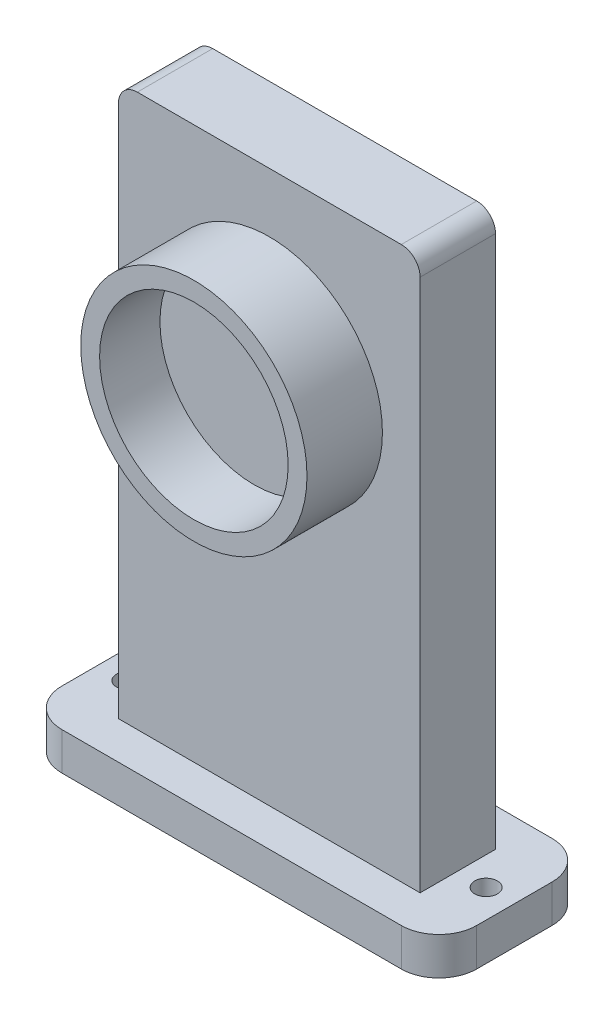
from build123d import *

# Parameters (mm, degrees)
SKETCH1_W           = 40
SKETCH1_H           = 110.7
BOSS_EXTRUDE1_DEPTH = 10
SKETCH4_R           = 15
BOSS_EXTRUDE3_DEPTH = 10
SKETCH5_R           = 12.5
CUT_EXTRUDE2_DEPTH  = 8
SKETCH6_W           = 40
SKETCH6_H           = 10
CUT_EXTRUDE3_DEPTH  = 32.5
FILLET4_R           = 2.5
SKETCH11_R          = 1.5
SKETCH11_W          = 40
SKETCH11_H          = 10
BOSS_EXTRUDE4_DEPTH = 5


with BuildPart() as part:
    # Sketch1 → Boss-Extrude1 (new body)
    with BuildSketch(Plane.XY):
        Rectangle(SKETCH1_W, SKETCH1_H)
    extrude(amount=BOSS_EXTRUDE1_DEPTH)

    # Sketch4 → Boss-Extrude3 (add)
    with BuildSketch(Plane.XY.offset(10)):
        Circle(SKETCH4_R)
    extrude(amount=BOSS_EXTRUDE3_DEPTH)

    # Sketch5 → Cut-Extrude2 (cut)
    with BuildSketch(Plane.XY.offset(20)):
        Circle(SKETCH5_R)
    extrude(amount=-CUT_EXTRUDE2_DEPTH, mode=Mode.SUBTRACT)

    # Sketch6 → Cut-Extrude3 (cut)
    with BuildSketch(Plane(origin=(0, 55.35, 0), x_dir=(1, 0, 0), z_dir=(0, 1, 0))):
        with Locations((0, -5)):
            Rectangle(SKETCH6_W, SKETCH6_H)
    extrude(amount=-CUT_EXTRUDE3_DEPTH, mode=Mode.SUBTRACT)

    # Fillet4
    fillet4_edges = [part.edges().sort_by_distance(p)[0] for p in [
        (20, 22.85, 5),
        (-20, 22.85, 5),
    ]]
    fillet(fillet4_edges, radius=FILLET4_R)

    # Sketch11 → Boss-Extrude4 (add)
    with BuildSketch(Plane.XZ.offset(55.35)):
        with BuildLine():
            Line((-22.5, 15), (22.5, 15))
            ThreePointArc((22.5, 15), (26.035533906, 13.535533906), (27.5, 10))
            Line((27.5, 10), (27.5, 0))
            ThreePointArc((27.5, 0), (26.035533906, -3.535533906), (22.5, -5))
            Line((22.5, -5), (-22.5, -5))
            ThreePointArc((-22.5, -5), (-26.035533906, -3.535533906), (-27.5, 0))
            Line((-27.5, 0), (-27.5, 10))
            ThreePointArc((-27.5, 10), (-26.035533906, 13.535533906), (-22.5, 15))
        make_face()
        with Locations((-23.75, 5)):
            Circle(SKETCH11_R, mode=Mode.SUBTRACT)
        with Locations((23.75, 5)):
            Circle(SKETCH11_R, mode=Mode.SUBTRACT)
        with Locations((0, 5)):
            Rectangle(SKETCH11_W, SKETCH11_H, mode=Mode.SUBTRACT)
    extrude(amount=-BOSS_EXTRUDE4_DEPTH)


solid = part.part
